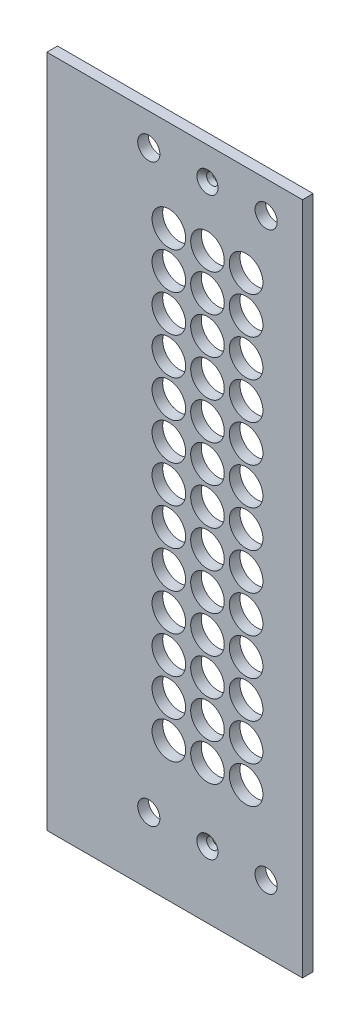
from build123d import *

# Parameters (mm, degrees)
SKETCH1_W                                       = 56.55
SKETCH1_H                                       = 197.425
BOSS_EXTRUDE1_DEPTH                             = 3.175
SKETCH4_R                                       = 5
CUT_EXTRUDE2_DEPTH                              = 103.731270343
LPATTERN3_COUNT                                 = 13
LPATTERN3_PITCH                                 = 11
SKETCH5_W                                       = 3.175
SKETCH5_H                                       = 197.425
BOSS_EXTRUDE2_DEPTH                             = 19.525
CSK_FOR_M3_FLAT_HEAD_MACHINE_SCREW1_D           = 3.4
CSK_FOR_M3_FLAT_HEAD_MACHINE_SCREW1_CSINK_D     = 6.3
CSK_FOR_M3_FLAT_HEAD_MACHINE_SCREW1_CSINK_ANGLE = 90
M6_CLEARANCE_HOLE1_D                            = 6.6
SKETCH14_W                                      = 76.075
SKETCH14_H                                      = 3.175
BOSS_EXTRUDE3_DEPTH                             = 3.175


with BuildPart() as part:
    # Sketch1 → Boss-Extrude1 (new body)
    with BuildSketch(Plane.XY):
        Rectangle(SKETCH1_W, SKETCH1_H)
    extrude(amount=BOSS_EXTRUDE1_DEPTH)

    # Sketch4 → Cut-Extrude2 (cut, through all)
    with BuildSketch(Plane.XY.offset(3.175)):
        with Locations((0, -57.369162839)):
            Circle(SKETCH4_R)
        with Locations((11.5, -57.369162839)):
            Circle(SKETCH4_R)
        with Locations((-11.5, -57.369162839)):
            Circle(SKETCH4_R)
    cut_extrude2 = extrude(amount=-CUT_EXTRUDE2_DEPTH, mode=Mode.SUBTRACT)

    # LPattern3: Cut-Extrude2 ×13
    with Locations(*[(0, i * LPATTERN3_PITCH, 0) for i in range(1, LPATTERN3_COUNT)]):
        add(cut_extrude2, mode=Mode.SUBTRACT)

    # Sketch5 → Boss-Extrude2 (add)
    with BuildSketch(Plane.ZY.offset(28.275)):
        with Locations((1.5875, 0)):
            Rectangle(SKETCH5_W, SKETCH5_H)
    extrude(amount=BOSS_EXTRUDE2_DEPTH)

    # CSK for M3 Flat Head Machine Screw1 (through all)
    with Locations(Plane.XY.offset(3.175)):
        with Locations((0, 92.3625001), (0, -78.8874999)):
            CounterSinkHole(CSK_FOR_M3_FLAT_HEAD_MACHINE_SCREW1_D / 2, CSK_FOR_M3_FLAT_HEAD_MACHINE_SCREW1_CSINK_D / 2, counter_sink_angle=CSK_FOR_M3_FLAT_HEAD_MACHINE_SCREW1_CSINK_ANGLE)

    # M6 Clearance Hole1 (through all)
    with Locations(Plane.XY.offset(3.175)):
        with Locations((-17.4625, -78.8874999), (17.4625, -78.8874999), (-17.4625, 92.3625001), (17.4625, 92.3625001)):
            Hole(M6_CLEARANCE_HOLE1_D / 2)

    # Sketch14 → Boss-Extrude3 (add)
    with BuildSketch(Plane(origin=(0, 98.7125, 0), x_dir=(1, 0, 0), z_dir=(0, 1, 0))):
        with Locations((-9.7625, -1.5875)):
            Rectangle(SKETCH14_W, SKETCH14_H)
    extrude(amount=BOSS_EXTRUDE3_DEPTH)


solid = part.part
